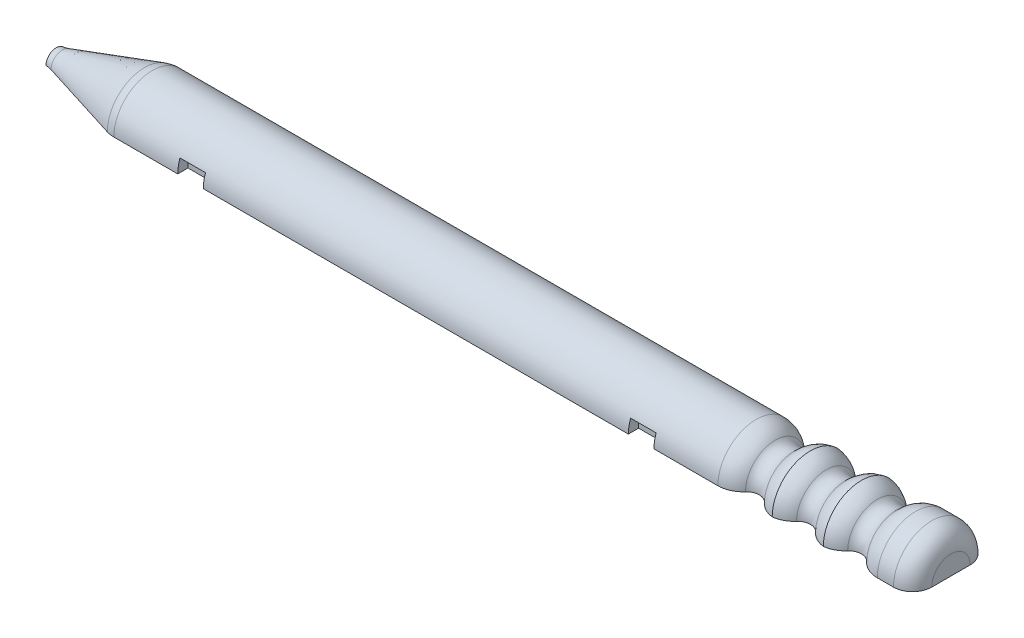
from build123d import *

# Parameters (mm, degrees)
REVOLVE1_ANGLE     = 180
FILLET1_ANGLE      = 180
FILLET1_2_ANGLE    = 180
SKETCH2_W          = 2
SKETCH2_H          = 0.8
CUT_EXTRUDE1_DEPTH = 1


with BuildPart() as part:
    # Sketch1 → Revolve1 (revolve)
    with BuildSketch(Plane(origin=(0, 0, 0), x_dir=(1, 0, 0), z_dir=(0, 1, 0))):
        with BuildLine():
            Line((0, 0), (-70, 0))
            Line((-70, 0), (-70, 0.8))
            Line((-70, 0.8), (-69.8, 0.8))
            Line((-69.8, 0.8), (-62.8, 3))
            Line((-62.8, 3), (-14, 3))
            ThreePointArc((-14, 3), (-13, 2), (-12, 3))
            Line((-12, 3), (-10, 3))
            ThreePointArc((-10, 3), (-9, 2), (-8, 3))
            Line((-8, 3), (-6, 3))
            ThreePointArc((-6, 3), (-5, 2), (-4, 3))
            Line((-4, 3), (-1.5, 3))
            ThreePointArc((-1.5, 3), (-0.439339828, 2.560660172), (0, 1.5))
            Line((0, 1.5), (0, 0))
        make_face()
    revolve(axis=Axis((0, 0, 0), (1, 0, 0)), revolution_arc=REVOLVE1_ANGLE)

    # Fillet1: read off the stored shape, not the designer's step
    # Fillet1 outline → Fillet1 (revolve)
    with BuildSketch(Plane(origin=(0, 0, 0), x_dir=(0, 0, -1), z_dir=(0, -1, 0))):
        with BuildLine():
            Line((0.8, -69.518311709), (0.8, -70))
            ThreePointArc((0.8, -70), (0.829465257, -69.75643572), (0.888530606, -69.518311709))
            Line((0.888530606, -69.518311709), (0.8, -69.518311709))
        make_face()
    revolve(axis=Axis((0, 0, 0), (1, 0, 0)), revolution_arc=FILLET1_ANGLE)

    # Fillet1 2 outline → Fillet1 2 (revolve, cut)
    with BuildSketch(Plane(origin=(0, 0, 0), x_dir=(0, 0, -1), z_dir=(0, -1, 0))):
        with BuildLine():
            ThreePointArc((3, -62.493114063), (2.976863029, -62.796449795), (2.907987434, -63.092767256))
            Line((2.907987434, -63.092767256), (3, -63.092767256))
            Line((3, -63.092767256), (3, -62.493114063))
        make_face()
        with BuildLine():
            Line((3, -15.236067977), (3, -13.745355992))
            Line((3, -13.745355992), (2.333333333, -13.745355992))
            ThreePointArc((2.333333333, -13.745355992), (2.825741858, -14.419571396), (3, -15.236067977))
        make_face()
        with BuildLine():
            Line((2.333333333, -12.254644008), (3, -12.254644008))
            Line((3, -12.254644008), (3, -9.745355992))
            Line((3, -9.745355992), (2.333333333, -9.745355992))
            ThreePointArc((2.333333333, -9.745355992), (2.774276771, -10.313060967), (2.986019111, -11))
            ThreePointArc((2.986019111, -11), (2.774276771, -11.686939033), (2.333333333, -12.254644008))
        make_face()
        with BuildLine():
            Line((2.333333333, -8.254644008), (3, -8.254644008))
            Line((3, -8.254644008), (3, -5.745355992))
            Line((3, -5.745355992), (2.333333333, -5.745355992))
            ThreePointArc((2.333333333, -5.745355992), (2.774276771, -6.313060967), (2.986019111, -7))
            ThreePointArc((2.986019111, -7), (2.774276771, -7.686939033), (2.333333333, -8.254644008))
        make_face()
        with BuildLine():
            Line((2.333333333, -4.254644008), (3, -4.254644008))
            Line((3, -4.254644008), (3, -2.763932023))
            ThreePointArc((3, -2.763932023), (2.825741858, -3.580428604), (2.333333333, -4.254644008))
        make_face()
    revolve(axis=Axis((0, 0, 0), (1, 0, 0)), revolution_arc=FILLET1_2_ANGLE, mode=Mode.SUBTRACT)

    # Sketch2 → Cut-Extrude1 (cut)
    with BuildSketch(Plane.XZ):
        with Locations((-56.493114063, -2.6)):
            Rectangle(SKETCH2_W, SKETCH2_H)
        with Locations((-21.236067977, -2.6)):
            Rectangle(SKETCH2_W, SKETCH2_H)
        with Locations((-21.236067977, 2.6)):
            Rectangle(SKETCH2_W, SKETCH2_H)
        with Locations((-56.493114063, 2.6)):
            Rectangle(SKETCH2_W, SKETCH2_H)
    extrude(amount=-CUT_EXTRUDE1_DEPTH, mode=Mode.SUBTRACT)


solid = part.part
